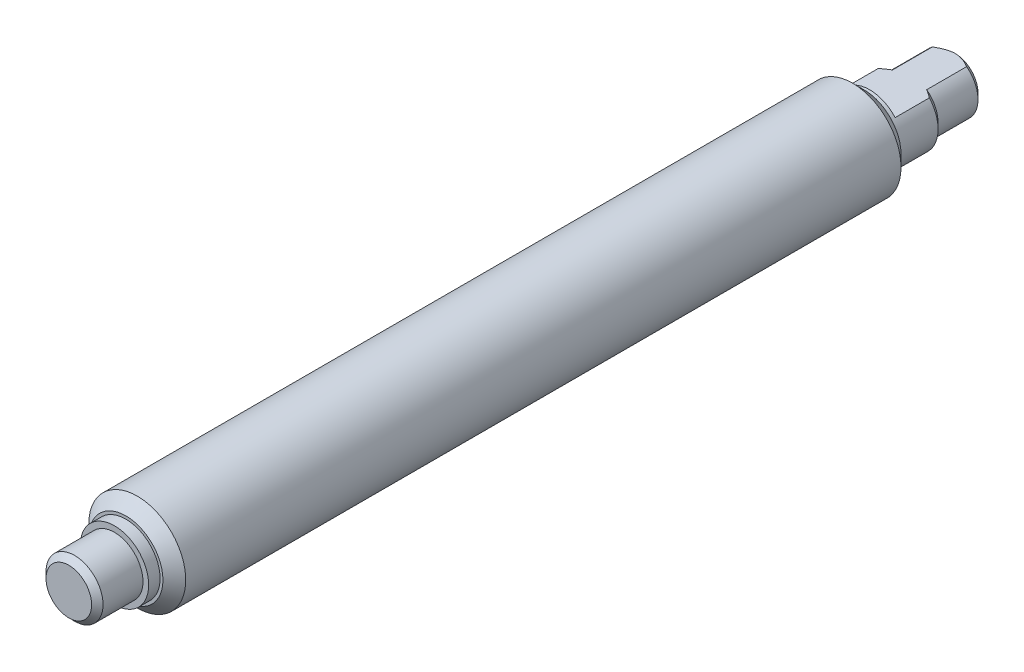
from build123d import *

# Parameters (mm, degrees)
SKETCH_1_R          = 4.25
EXTRUDE_1_DEPTH     = 32.35
SKETCH_2_R          = 3
EXTRUDE_2_DEPTH     = 1
SKETCH_3_R          = 2.5
EXTRUDE_3_DEPTH     = 4
EXTRUDE_START       = 4
SKETCH_4_R          = 3
EXTRUDE_4_DEPTH     = 4
SKETCH_5_R          = 2.5
EXTRUDE_5_DEPTH     = 4
CHAMFER_1_SIZE      = 0.5
CHAMFER_2_SIZE      = 0.5
SKETCH_6_W          = 6
SKETCH_6_H          = 3
CUT_EXTRUDE_6_DEPTH = 7.5
CHAMFER1_SIZE       = 1


with BuildPart() as part:
    # 草图1 → 拉伸1 (new, symmetric)
    with BuildSketch(Plane.XY):
        with Locations(Location((0, 0, 0), (0, 0, 180))):
            Circle(SKETCH_1_R)
    extrude(amount=EXTRUDE_1_DEPTH, both=True)

    # 草图2 → 拉伸2 (add)
    with BuildSketch(Plane.XY.offset(32.35)):
        Circle(SKETCH_2_R)
    extrude(amount=EXTRUDE_2_DEPTH)

    # 草图3 → 拉伸3 (add)
    with BuildSketch(Plane.XY.offset(33.35)):
        Circle(SKETCH_3_R)
    extrude(amount=EXTRUDE_3_DEPTH)

    # 草图4 → 拉伸4 (add)
    with BuildSketch(Plane(origin=(0, 0, -32.35), x_dir=(-1, 0, 0), z_dir=(0, 0, -1)).offset(EXTRUDE_START)):
        with Locations(Location((0, 0, 0), (0, 0, 180))):
            Circle(SKETCH_4_R)
    extrude(amount=-EXTRUDE_4_DEPTH)

    # 草图5 → 拉伸5 (add)
    with BuildSketch(Plane(origin=(0, 0, -36.35), x_dir=(-1, 0, 0), z_dir=(0, 0, -1)).offset(EXTRUDE_START)):
        with Locations(Location((0, 0, 0), (0, 0, 180))):
            Circle(SKETCH_5_R)
    extrude(amount=-EXTRUDE_5_DEPTH)

    # 倒角1
    chamfer_1_edges = [part.edges().sort_by_distance(p)[0] for p in [
        (-2.5, 0, 37.35),
        (-2.5, 0, -40.35),
    ]]
    chamfer(chamfer_1_edges, length=CHAMFER_1_SIZE)

    # 倒角2
    chamfer_2_edges = [part.edges().sort_by_distance(p)[0] for p in [
        (-3, 0, -36.35),
    ]]
    chamfer(chamfer_2_edges, length=CHAMFER_2_SIZE - 0.0001)  # a hair under: the kernel refuses the full size

    # 草图6 → 拉伸6 (cut)
    with BuildSketch(Plane(origin=(0, 0, -40.35), x_dir=(-1, 0, 0), z_dir=(0, 0, -1))):
        with Locations((0, 3.5)):
            Rectangle(SKETCH_6_W, SKETCH_6_H)
    extrude(amount=-CUT_EXTRUDE_6_DEPTH, mode=Mode.SUBTRACT)

    # Chamfer1
    chamfer1_edges = [part.edges().sort_by_distance(p)[0] for p in [
        (4.25, 0, -32.35),
        (4.25, 0, 32.35),
    ]]
    chamfer(chamfer1_edges, length=CHAMFER1_SIZE)


solid = part.part
